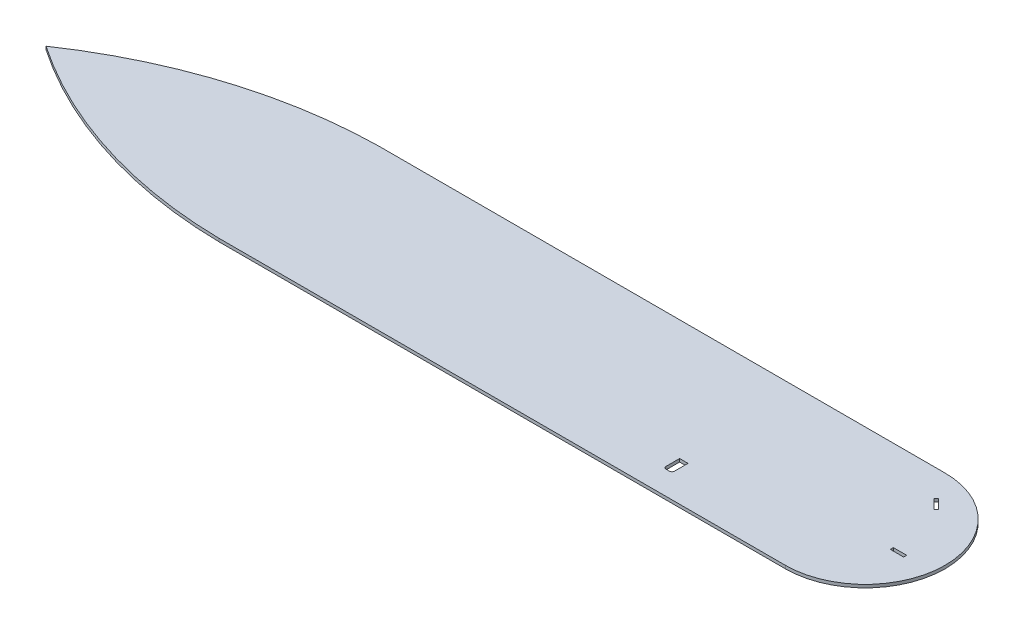
from build123d import *

# Parameters (mm, degrees)
BOSS_EXTRUDE1_DEPTH = 3
SKETCH2_W           = 13
SKETCH2_H           = 3
CUT_EXTRUDE1_DEPTH  = 892.756132583


with BuildPart() as part:
    # Sketch1 → Boss-Extrude1 (new body)
    with BuildSketch(Plane(origin=(0, 0, 0), x_dir=(1, 0, 0), z_dir=(0, 1, 0))):
        with BuildLine():
            Line((247.069884649, 0), (800, 0))
            ThreePointArc((800, 0), (878, 78), (800, 156))
            Line((800, 156), (247.069884649, 156))
            ThreePointArc((247.069884649, 156), (117.814256938, 135.120629211), (0, 78))
            ThreePointArc((0, 78), (117.814256938, 20.879370789), (247.069884649, 0))
        make_face()
    extrude(amount=BOSS_EXTRUDE1_DEPTH)

    # Sketch2 → Cut-Extrude1 (cut, through all)
    with BuildSketch(Plane.XZ):
        Polygon((825.400313424, -119.720800043), (816.207925269, -128.913188198), (818.329245612, -131.034508541), (827.521633768, -121.842120386), align=None)
        with Locations((844.25500509, -66.196677143)):
            Rectangle(SKETCH2_W, SKETCH2_H)
        with BuildLine():
            Line((658.069884649, -25.47338103), (658.069884649, -38.67338103))
            Line((658.069884649, -38.67338103), (666.269884649, -38.67338103))
            Line((666.269884649, -38.67338103), (666.269884649, -25.47338103))
            ThreePointArc((666.269884649, -25.47338103), (665.537651602, -23.705614077), (663.769884649, -22.97338103))
            Line((663.769884649, -22.97338103), (660.569884649, -22.97338103))
            ThreePointArc((660.569884649, -22.97338103), (658.802117696, -23.705614077), (658.069884649, -25.47338103))
        make_face()
    extrude(amount=-CUT_EXTRUDE1_DEPTH, mode=Mode.SUBTRACT)


solid = part.part
